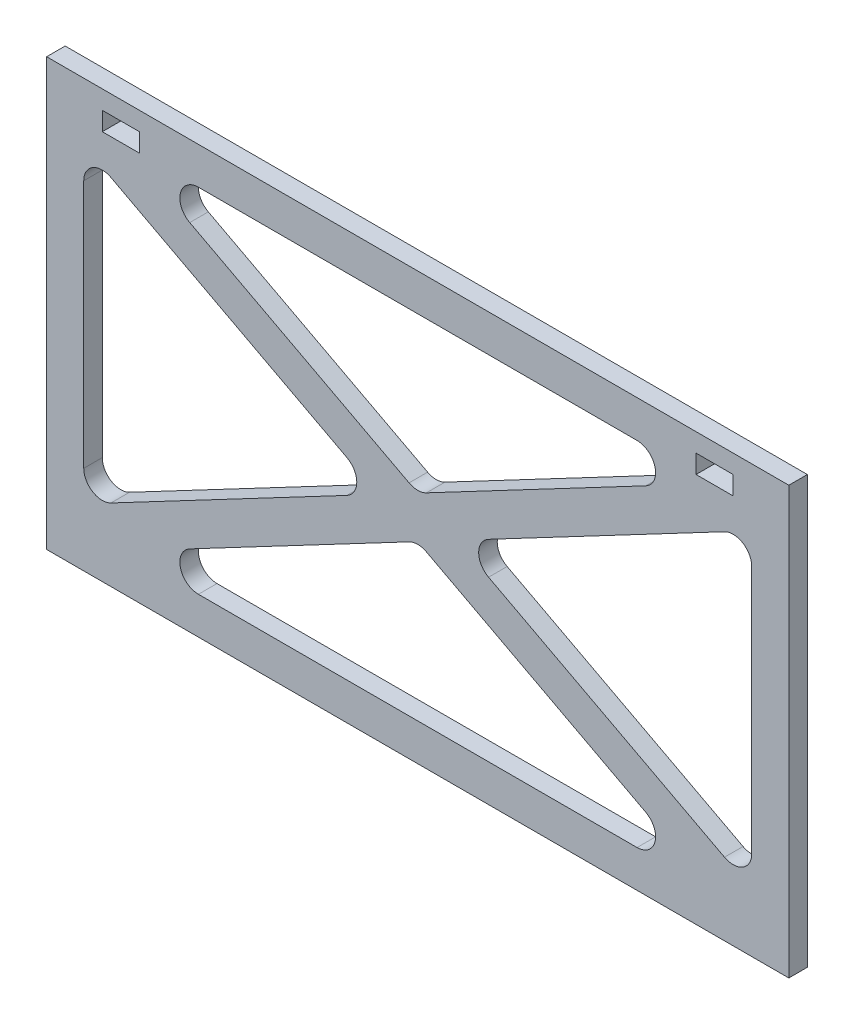
from build123d import *

# Parameters (mm, degrees)
SKETCH1_W               = 203.2
SKETCH1_H               = 116.84
BOSS_EXTRUDE1_DEPTH     = 5.08
FILLET1_R               = 5.08
CUT_EXTRUDE1_DEPTH      = 118.308408906
CUT_EXTRUDE1_DEPTH_BACK = 118.308408906
SKETCH2_W               = 10.16
SKETCH2_H               = 5.08


with BuildPart() as part:
    # Sketch1 → Boss-Extrude1 (new body)
    with BuildSketch(Plane.XY):
        Rectangle(SKETCH1_W, SKETCH1_H)
        Polygon((10.883569766, 0), (91.44, 42.515893734), (91.44, -42.515893734), align=None, mode=Mode.SUBTRACT)
        Polygon((80.556430234, 48.26), (0, 5.744106266), (-80.556430234, 48.26), align=None, mode=Mode.SUBTRACT)
        Polygon((-91.44, -42.515893734), (-91.44, 42.515893734), (-10.883569766, 0), align=None, mode=Mode.SUBTRACT)
        Polygon((80.556430234, -48.26), (-80.556430234, -48.26), (0, -5.744106266), align=None, mode=Mode.SUBTRACT)
    extrude(amount=BOSS_EXTRUDE1_DEPTH)

    # Fillet1
    fillet1_edges = [part.edges().sort_by_distance(p)[0] for p in [
        (10.883569766, 0, 2.54),
        (91.44, -42.515893734, 2.54),
        (80.556430234, -48.26, 2.54),
        (-80.556430234, -48.26, 2.54),
        (91.44, 42.515893734, 2.54),
        (80.556430234, 48.26, 2.54),
        (-80.556430234, 48.26, 2.54),
        (0, -5.744106266, 2.54),
        (-10.883569766, 0, 2.54),
        (0, 5.744106266, 2.54),
        (-91.44, -42.515893734, 2.54),
        (-91.44, 42.515893734, 2.54),
    ]]
    fillet(fillet1_edges, radius=FILLET1_R)

    # Sketch2 → Cut-Extrude1 (cut, two sides: drawn at the far end of the back side and taken through both)
    with BuildSketch(Plane.XY.offset(5.08).offset(-CUT_EXTRUDE1_DEPTH_BACK)):
        with Locations((-81.28, 50.8)):
            Rectangle(SKETCH2_W, SKETCH2_H)
        with Locations((81.28, 50.8)):
            Rectangle(SKETCH2_W, SKETCH2_H)
    extrude(amount=CUT_EXTRUDE1_DEPTH + CUT_EXTRUDE1_DEPTH_BACK, mode=Mode.SUBTRACT)


solid = part.part
